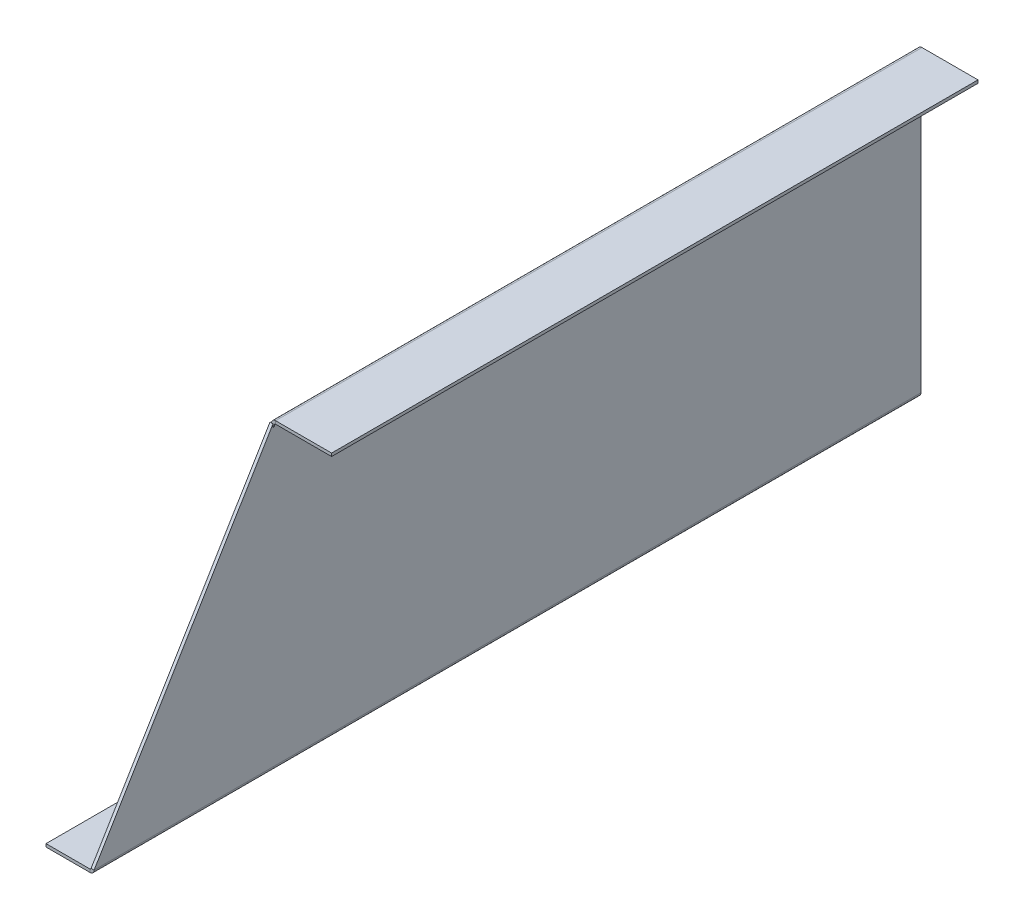
from build123d import *

# Parameters (mm, degrees)
BASE_FLANGE1_DEPTH            = 550
CUT_EXTRUDE1_REACH            = 588.109
EDGE_FLANGE1_STRIP_W          = 9.4732
EDGE_FLANGE1_STRIP_H          = 2
EDGE_FLANGE1_STRIP_CUT_DEPTH  = 430
EDGE_FLANGE1_RELIEF_W         = 10.4732
EDGE_FLANGE1_RELIEF_H         = 1
EDGE_FLANGE1_RELIEF_CUT_DEPTH = 2
EDGE_FLANGE1_DEPTH            = 430


# Sheet-metal steps are written as plain solids
with BuildPart() as part:
    # Sketch1 → Base-Flange1 (new body)
    with BuildSketch(Plane.XY):
        with BuildLine():
            Line((0, 0), (29.2634, 0))
            ThreePointArc((29.2634, 0), (29.784254855, 0.215745145), (30, 0.7366))
            Line((30, 0.7366), (30, 200))
            Line((30, 200), (32, 200))
            Line((32, 200), (32, 0.7366))
            ThreePointArc((32, 0.7366), (31.198468417, -1.198468417), (29.2634, -2))
            Line((29.2634, -2), (0, -2))
            Line((0, -2), (0, 0))
        make_face()
    extrude(amount=BASE_FLANGE1_DEPTH)

    # Sketch6 → Cut-Extrude1 (cut, up to next)
    with BuildSketch(Plane(origin=(32, 0, 0), x_dir=(0, 0, -1), z_dir=(1, 0, 0)), mode=Mode.PRIVATE) as cut_extrude1_sk1:
        Polygon((-550, 0.7366), (-430, 200), (-550, 200), align=None)
    cut_extrude1_tool1 = extrude(cut_extrude1_sk1.sketch, amount=-CUT_EXTRUDE1_REACH, mode=Mode.PRIVATE) & part.part
    add(cut_extrude1_tool1.solids().sort_by_distance((32, 133.578867, 510))[0], mode=Mode.SUBTRACT)

    # Edge-Flange1 strip (across the edge) → Edge-Flange1 strip cut (cut)
    with BuildSketch(Plane(origin=(32, 200, 0), x_dir=(0, -1, 0), z_dir=(0, 0, 1))):
        with Locations((-2, -1)):
            Rectangle(EDGE_FLANGE1_STRIP_W, EDGE_FLANGE1_STRIP_H)
    extrude(amount=EDGE_FLANGE1_STRIP_CUT_DEPTH, mode=Mode.SUBTRACT)

    # Edge-Flange1 relief (on the sheet) → Edge-Flange1 relief cut (cut)
    with BuildSketch(Plane(origin=(32, 197.2634, 0), x_dir=(0, -1, 0), z_dir=(1, 0, 0))):
        with Locations((-4.2366, -430.5)):
            Rectangle(EDGE_FLANGE1_RELIEF_W, EDGE_FLANGE1_RELIEF_H)
    extrude(amount=-EDGE_FLANGE1_RELIEF_CUT_DEPTH, mode=Mode.SUBTRACT)

    # Edge-Flange1 section (across the edge) → Edge-Flange1 (add)
    with BuildSketch(Plane(origin=(32, 200, 0), x_dir=(0, -1, 0), z_dir=(0, 0, 1))):
        with BuildLine():
            Line((0, 0.7366), (0, 38))
            Line((0, 38), (2, 38))
            Line((2, 38), (2, 0.7366))
            ThreePointArc((2, 0.7366), (2.215745145, 0.215745145), (2.7366, 0))
            Line((2.7366, 0), (2.7366, -2))
            ThreePointArc((2.7366, -2), (0.801531583, -1.198468417), (0, 0.7366))
        make_face()
    extrude(amount=EDGE_FLANGE1_DEPTH)


solid = part.part
